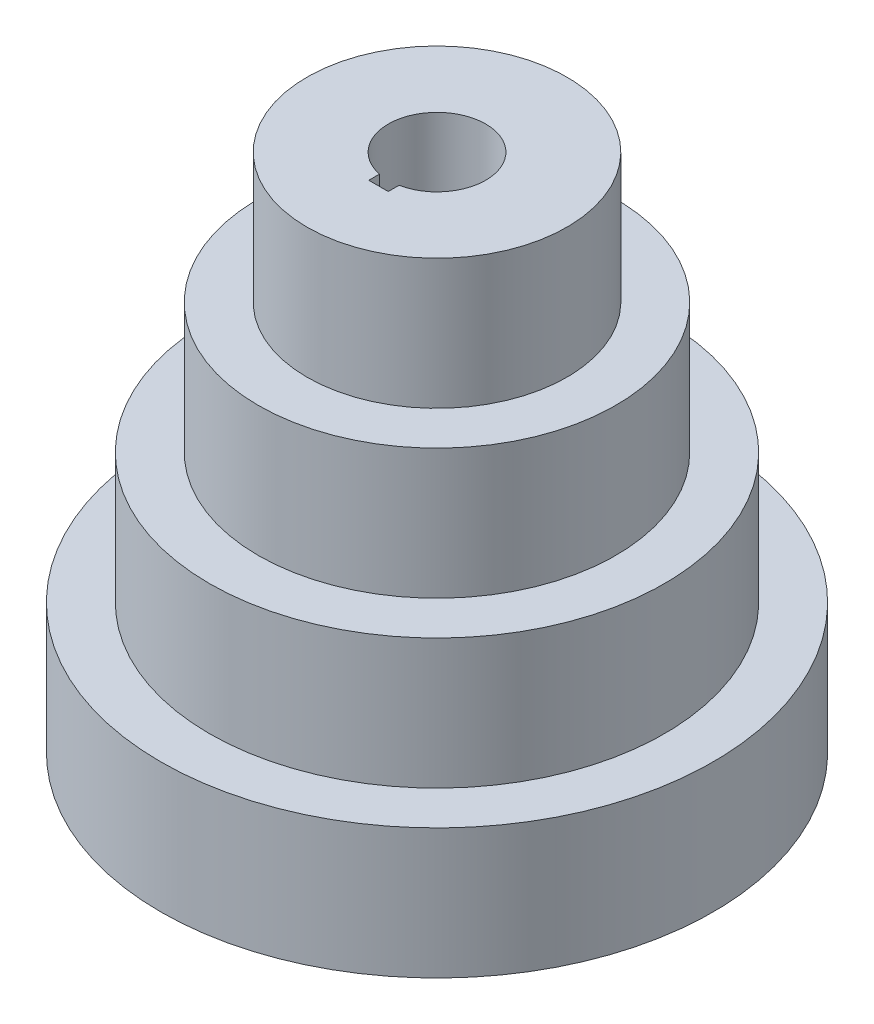
from build123d import *

# Parameters (mm, degrees)
SKETCH1_R            = 85
BOSS_EXTRUDE1_DEPTH  = 40
SKETCH2_R            = 70
BOSS_EXTRUDE2_DEPTH  = 40
SKETCH3_R            = 55
BOSS_EXTRUDE3_DEPTH  = 40
SKETCH4_R            = 40
BOSS_EXTRUDE4_DEPTH  = 40
SKETCH5_R            = 15
SKETCH5_W            = 6
SKETCH5_H            = 6
CUT_EXTRUDE1_DEPTH   = 201.124960962
SHELL1_OUTLINE_R     = 60
SHELL1_DEPTH         = 70
SHELL1_2_OUTLINE_R   = 75
SHELL1_2_OUTLINE_R_2 = 60
SHELL1_2_DEPTH       = 30
SHELL1_START         = 70
SHELL1_3_OUTLINE_R   = 45
SHELL1_3_DEPTH       = 40
SHELL1_START_2       = 110
SHELL1_4_DEPTH       = 40


# Read off the part's stored shape, not the designer's step: Shell1
with BuildPart() as part:
    # Sketch1 → Boss-Extrude1 (new body)
    with BuildSketch(Plane(origin=(0, 0, 0), x_dir=(1, 0, 0), z_dir=(0, 1, 0))):
        with Locations(Location((0, 0, 0), (0, 0, 270))):
            Circle(SKETCH1_R)
    extrude(amount=BOSS_EXTRUDE1_DEPTH)

    # Sketch2 → Boss-Extrude2 (add)
    with BuildSketch(Plane(origin=(0, 40, 0), x_dir=(1, 0, 0), z_dir=(0, 1, 0))):
        with Locations(Location((0, 0, 0), (0, 0, 270))):
            Circle(SKETCH2_R)
    extrude(amount=BOSS_EXTRUDE2_DEPTH)

    # Sketch3 → Boss-Extrude3 (add)
    with BuildSketch(Plane(origin=(0, 80, 0), x_dir=(1, 0, 0), z_dir=(0, 1, 0))):
        with Locations(Location((0, 0, 0), (0, 0, 270))):
            Circle(SKETCH3_R)
    extrude(amount=BOSS_EXTRUDE3_DEPTH)

    # Sketch4 → Boss-Extrude4 (add)
    with BuildSketch(Plane(origin=(0, 120, 0), x_dir=(1, 0, 0), z_dir=(0, 1, 0))):
        with Locations(Location((0, 0, 0), (0, 0, 270))):
            Circle(SKETCH4_R)
    extrude(amount=BOSS_EXTRUDE4_DEPTH)

    # Sketch5 → Cut-Extrude1 (cut, through all)
    with BuildSketch(Plane(origin=(0, 160, 0), x_dir=(1, 0, 0), z_dir=(0, 1, 0))):
        Circle(SKETCH5_R)
        with Locations((0, -15)):
            Rectangle(SKETCH5_W, SKETCH5_H)
    extrude(amount=-CUT_EXTRUDE1_DEPTH, mode=Mode.SUBTRACT)

    # Shell1 outline → Shell1 (cut)
    with BuildSketch(Plane(origin=(0, 0, 0), x_dir=(1, 0, 0), z_dir=(0, 1, 0))):
        Circle(SHELL1_OUTLINE_R)
        with BuildLine():
            Line((13, -21.354156504), (13, -28))
            Line((13, -28), (-13, -28))
            Line((-13, -28), (-13, -21.354156504))
            ThreePointArc((-13, -21.354156504), (0, 25), (13, -21.354156504))
        make_face(mode=Mode.SUBTRACT)
    extrude(amount=SHELL1_DEPTH, mode=Mode.SUBTRACT)

    # Shell1 2 outline → Shell1 2 (cut)
    with BuildSketch(Plane(origin=(0, 0, 0), x_dir=(1, 0, 0), z_dir=(0, 1, 0))):
        Circle(SHELL1_2_OUTLINE_R)
        Circle(SHELL1_2_OUTLINE_R_2, mode=Mode.SUBTRACT)
    extrude(amount=SHELL1_2_DEPTH, mode=Mode.SUBTRACT)

    # Shell1 3 outline → Shell1 3 (cut)
    with BuildSketch(Plane(origin=(0, 0, 0), x_dir=(1, 0, 0), z_dir=(0, 1, 0)).offset(SHELL1_START)):
        Circle(SHELL1_3_OUTLINE_R)
        with BuildLine():
            Line((13, -21.354156504), (13, -28))
            Line((13, -28), (-13, -28))
            Line((-13, -28), (-13, -21.354156504))
            ThreePointArc((-13, -21.354156504), (0, 25), (13, -21.354156504))
        make_face(mode=Mode.SUBTRACT)
    extrude(amount=SHELL1_3_DEPTH, mode=Mode.SUBTRACT)

    # Shell1 4 outline → Shell1 4 (cut)
    with BuildSketch(Plane(origin=(0, 0, 0), x_dir=(1, 0, 0), z_dir=(0, 1, 0)).offset(SHELL1_START_2)):
        with BuildLine():
            Line((13, -21.354156504), (13, -27.037011669))
            ThreePointArc((13, -27.037011669), (0, 30), (-13, -27.037011669))
            Line((-13, -27.037011669), (-13, -21.354156504))
            ThreePointArc((-13, -21.354156504), (0, 25), (13, -21.354156504))
        make_face()
        with BuildLine():
            ThreePointArc((-10.770329614, -28), (0, -30), (10.770329614, -28))
            Line((10.770329614, -28), (-10.770329614, -28))
        make_face()
    extrude(amount=SHELL1_4_DEPTH, mode=Mode.SUBTRACT)


solid = part.part
